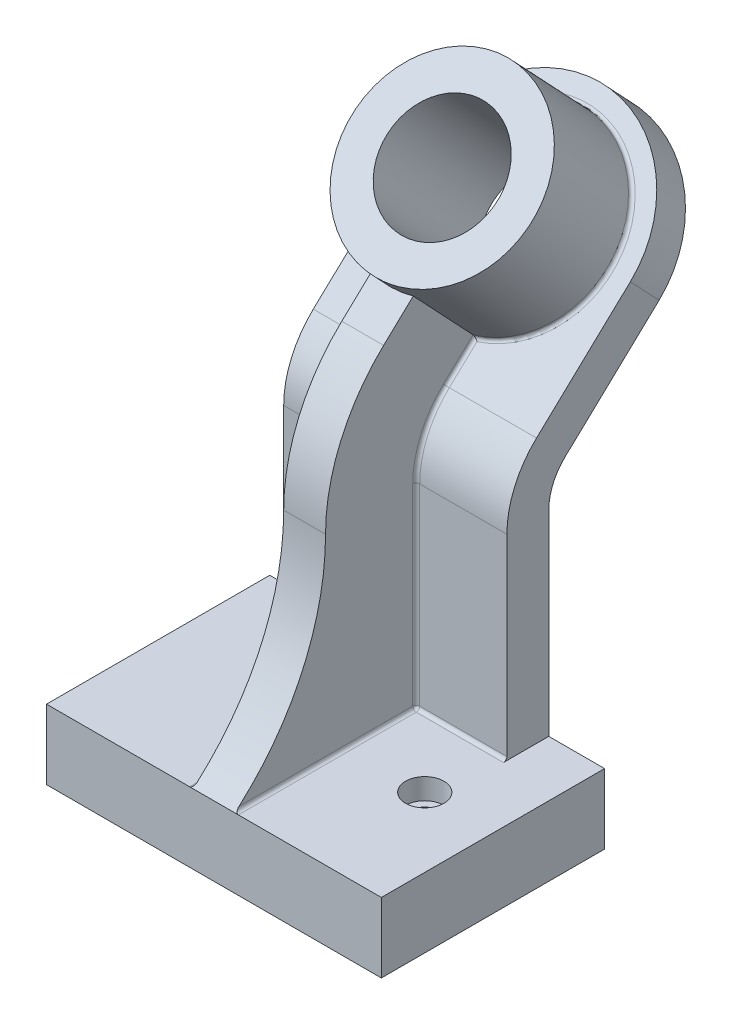
from build123d import *

# Parameters (mm, degrees)
SKETCH4_W                      = 96
SKETCH4_H                      = 64
BOSS_EXTRUDE1_DEPTH            = 20
BOSS_EXTRUDE2_DEPTH            = 32
BOSS_EXTRUDE3_DEPTH            = 12
SKETCH7_R                      = 26
SKETCH7_R_2                    = 16
BOSS_EXTRUDE4_DEPTH            = 32
CUT_EXTRUDE1_START             = -32
SKETCH8_R                      = 16
CUT_EXTRUDE1_DEPTH             = 32
RIB1_START                     = -6
RIB1_DEPTH                     = 12
FILLET1_R                      = 1
CBORE_FOR_M6_SHCS2_D           = 6.6
CBORE_FOR_M6_SHCS2_CBORE_D     = 11
CBORE_FOR_M6_SHCS2_CBORE_DEPTH = 6


with BuildPart() as part:
    # Sketch4 → Boss-Extrude1 (new body)
    with BuildSketch(Plane(origin=(0, 0, 0), x_dir=(1, 0, 0), z_dir=(0, 1, 0))):
        Rectangle(SKETCH4_W, SKETCH4_H)
    extrude(amount=BOSS_EXTRUDE1_DEPTH)

    # Sketch5 → Boss-Extrude2 (add, symmetric)
    with BuildSketch(Plane(origin=(0, 0, 0), x_dir=(0, 0, -1), z_dir=(1, 0, 0))):
        with BuildLine():
            Line((20, 0), (32, 0))
            Line((32, 0), (32, 76.178360588))
            ThreePointArc((32, 76.178360588), (33.228648741, 82.123937475), (36.713317934, 87.095510953))
            Line((36.713317934, 87.095510953), (63.616851895, 112.445358766))
            Line((63.616851895, 112.445358766), (55.387506243, 121.179079058))
            Line((55.387506243, 121.179079058), (28.483972282, 95.829231245))
            ThreePointArc((28.483972282, 95.829231245), (22.211567734, 86.880398983), (20, 76.178360588))
            Line((20, 76.178360588), (20, 0))
        make_face()
    extrude(amount=BOSS_EXTRUDE2_DEPTH, both=True)

    # Sketch6 → Boss-Extrude3 (add)
    with BuildSketch(Plane(origin=(0, 36.544630029, 34.434168053), x_dir=(1, 0, 0), z_dir=(0, 0.7278100243036815, 0.6857788043699474))):
        with BuildLine():
            Line((-32, 123.413626216), (32, 123.413626216))
            ThreePointArc((32, 123.413626216), (0, 155.413626216), (-32, 123.413626216))
        make_face()
    extrude(amount=-BOSS_EXTRUDE3_DEPTH)

    # Sketch7 → Boss-Extrude4 (add)
    with BuildSketch(Plane(origin=(0, 36.544630029, 34.434168053), x_dir=(1, 0, 0), z_dir=(0, 0.7278100243036815, 0.6857788043699474))):
        with Locations(Location((0, 123.413626216, 0), (0, 0, 270))):
            Circle(SKETCH7_R)
        with Locations(Location((0, 123.413626216, 0), (0, 0, 270))):
            Circle(SKETCH7_R_2, mode=Mode.SUBTRACT)
    extrude(amount=BOSS_EXTRUDE4_DEPTH)

    # Sketch8 → Cut-Extrude1 (cut)
    with BuildSketch(Plane(origin=(0, 36.544630029, 34.434168053), x_dir=(1, 0, 0), z_dir=(0, 0.7278100243036815, 0.6857788043699474)).offset(CUT_EXTRUDE1_START)):
        with Locations(Location((0, 123.413626216, 0), (0, 0, 270))):
            Circle(SKETCH8_R)
    extrude(amount=CUT_EXTRUDE1_DEPTH, mode=Mode.SUBTRACT)

    # Rib1: read off the stored shape, not the designer's step
    # Rib1 outline → Rib1 (add)
    with BuildSketch(Plane(origin=(0, 0, 0), x_dir=(0, 0, -1), z_dir=(1, 0, 0)).offset(RIB1_START)):
        with BuildLine():
            Line((28.483972282, 95.829231245), (36.975207197, 103.830095115))
            Line((36.975207197, 103.830095115), (19.144958284, 122.753155747))
            Line((19.144958284, 122.753155747), (10.653723368, 114.752291877))
            ThreePointArc((10.653723368, 114.752291877), (-1.658774448, 97.186065586), (-6, 76.178360588))
            ThreePointArc((-6, 76.178360588), (-12.815134364, 45.226752398), (-32, 20))
            Line((-32, 20), (20, 20))
            Line((20, 20), (20, 76.178360588))
            ThreePointArc((20, 76.178360588), (22.211567734, 86.880398983), (28.483972282, 95.829231245))
        make_face()
    extrude(amount=RIB1_DEPTH)

    # Fillet1
    # the kernel refuses this fillet: 1 mm, written as the material it adds along each edge
    with BuildSketch(Plane(origin=(7, 21, -19), x_dir=(-1, 0, 0), z_dir=(0, 0, -1))) as fillet1_piece_1_section:
        Polygon((0, 0), (FILLET1_R * 1.02, 0), (FILLET1_R * 1.02, -FILLET1_R * 1.02), (0, -FILLET1_R * 1.02), align=None)
    fillet1_piece_1 = extrude(amount=FILLET1_R * 1.02, mode=Mode.PRIVATE)
    fillet1_piece_1 = fillet1_piece_1 - Plane(origin=(7, 21, -19), x_dir=(0.7071067811865475, 0.7071067811865475, 0), z_dir=(0, 0, -1)) * Sphere(FILLET1_R, mode=Mode.PRIVATE)
    add(fillet1_piece_1)
    with BuildSketch(Plane(origin=(-7, 21, -19), x_dir=(1, 0, 0), z_dir=(0, 0, -1))) as fillet1_piece_2_section:
        Polygon((0, 0), (FILLET1_R * 1.02, 0), (FILLET1_R * 1.02, FILLET1_R * 1.02), (0, FILLET1_R * 1.02), align=None)
    fillet1_piece_2 = extrude(amount=FILLET1_R * 1.02, mode=Mode.PRIVATE)
    fillet1_piece_2 = fillet1_piece_2 - Plane(origin=(-7, 21, -19), x_dir=(-0.7071067811865475, 0.7071067811865475, 0), z_dir=(0, 0, -1)) * Sphere(FILLET1_R, mode=Mode.PRIVATE)
    add(fillet1_piece_2)
    with BuildSketch(Plane(origin=(7, 20, -20), x_dir=(0, 0, 1), z_dir=(1, 0, 0)), Plane(origin=(-32, 20, -20), x_dir=(0, 0, 1), z_dir=(1, 0, 0))) as fillet1_piece_3:
        with BuildLine():
            CenterArc((FILLET1_R, -FILLET1_R), FILLET1_R, 90, 90)
            Line((0, -FILLET1_R), (0, 0))
            Line((0, 0), (FILLET1_R, 0))
        make_face()
    extrude(amount=25)
    with BuildSketch(Plane(origin=(0, 121.179079058, -55.387506243), x_dir=(0.13576209912112866, -0.6794294979898851, 0.7210715704445971), z_dir=(-0.990741465995153, -0.09310277001404191, 0.09880901666086746))) as fillet1_piece_4:
        with BuildLine():
            CenterArc((26 + FILLET1_R, FILLET1_R), FILLET1_R, 180, 90)
            Line((26, FILLET1_R), (26, 0))
            Line((26, 0), (26 + FILLET1_R, 0))
        make_face()
    revolve(axis=Axis((0, 121.179079058, -55.387506243), (0, 0.7278100243036815, 0.6857788043699474)), revolution_arc=344.394618628)
    with BuildSketch(Plane(origin=(6, 21, -20), x_dir=(0, 0, 1), z_dir=(0, 1, 0)), Plane(origin=(-6, 21, -20), x_dir=(-1, 0, 0), z_dir=(0, 1, 0))) as fillet1_piece_5:
        with BuildLine():
            CenterArc((FILLET1_R, FILLET1_R), FILLET1_R, 180, 90)
            Line((0, FILLET1_R), (0, 0))
            Line((0, 0), (FILLET1_R, 0))
        make_face()
    extrude(amount=55.178360588)
    with BuildSketch(Plane(origin=(6, 76.178360589, -47.000000001), x_dir=(0, -1.928886679962007e-11, 1.0), z_dir=(0, -1.0, -1.928886679962007e-11))) as fillet1_piece_6:
        with BuildLine():
            CenterArc((27.000000001 + FILLET1_R, -FILLET1_R), FILLET1_R, 90, 90)
            Line((27.000000001, -FILLET1_R), (27.000000001, 0))
            Line((27.000000001, 0), (27.000000001 + FILLET1_R, 0))
        make_face()
    revolve(axis=Axis((6, 76.178360589, -47.000000001), (-1, 0, 0)), revolution_arc=46.703113482)
    with BuildSketch(Plane(origin=(6, 95.829231245, -28.483972282), x_dir=(0, 0.7278100243012071, 0.6857788043725734), z_dir=(0, 0.6857788043725734, -0.7278100243012071)), Plane(origin=(-6, 95.829231245, -28.483972282), x_dir=(-1.0, -2.1788147308559408e-10, -2.0529876082846627e-10), z_dir=(0, 0.6857788043725734, -0.7278100243012071))) as fillet1_piece_7:
        with BuildLine():
            CenterArc((FILLET1_R, FILLET1_R), FILLET1_R, 180, 90)
            Line((-FILLET1_R * 2.99381074515e-10, FILLET1_R), (0, 0))
            Line((0, 0), (FILLET1_R, 0))
        make_face()
    extrude(amount=14.166828749)
    with BuildSketch(Plane(origin=(6, 20, 34.5), x_dir=(1, 0, 0), z_dir=(0, 0, -1))) as fillet1_piece_8_section:
        with BuildLine():
            CenterArc((FILLET1_R, -FILLET1_R), FILLET1_R, 90, 90)
            Line((0, -FILLET1_R), (0, 0))
            Line((0, 0), (FILLET1_R, 0))
        make_face()
    fillet1_piece_8 = extrude(amount=53.5, mode=Mode.PRIVATE)
    fillet1_piece_8 = fillet1_piece_8 - Plane(origin=(6, 76.178360589, 79.692465356), x_dir=(0, -1.8148557691731866e-11, -1.0), z_dir=(-1, 0, 0)) * Cylinder(73.692465356, 111, mode=Mode.PRIVATE)
    add(fillet1_piece_8)
    with BuildSketch(Plane(origin=(-6, 20, 34.5), x_dir=(-1, 0, 0), z_dir=(0, 0, -1))) as fillet1_piece_9_section:
        with BuildLine():
            CenterArc((FILLET1_R, FILLET1_R), FILLET1_R, 180, 90)
            Line((0, FILLET1_R), (0, 0))
            Line((0, 0), (FILLET1_R, 0))
        make_face()
    fillet1_piece_9 = extrude(amount=53.5, mode=Mode.PRIVATE)
    fillet1_piece_9 = fillet1_piece_9 - Plane(origin=(-6, 76.178360589, 79.692465356), x_dir=(0, -1.8148557691731866e-11, -1.0), z_dir=(-1, 0, 0)) * Cylinder(73.692465356, 111, mode=Mode.PRIVATE)
    add(fillet1_piece_9)
    with BuildSketch(Plane(origin=(-6, 76.178360589, -47.000000001), x_dir=(0, -1.928886679962007e-11, 1.0), z_dir=(0, -1.0, -1.928886679962007e-11))) as fillet1_piece_10:
        with BuildLine():
            CenterArc((27.000000001 + FILLET1_R, FILLET1_R), FILLET1_R, 180, 90)
            Line((27.000000001 + FILLET1_R, 0), (27.000000001, 0))
            Line((27.000000001, 0), (27.000000001, FILLET1_R))
        make_face()
    revolve(axis=Axis((-6, 76.178360589, -47.000000001), (-1, 0, 0)), revolution_arc=46.703113482)

    # CBORE for M6 SHCS2 (through all)
    with Locations(Plane(origin=(28.094759236, 20, -0.341970782), x_dir=(0, 0, 1), z_dir=(0, 1, 0))):
        with Locations((0, 0)):
            CounterBoreHole(CBORE_FOR_M6_SHCS2_D / 2, CBORE_FOR_M6_SHCS2_CBORE_D / 2, CBORE_FOR_M6_SHCS2_CBORE_DEPTH)


solid = part.part
